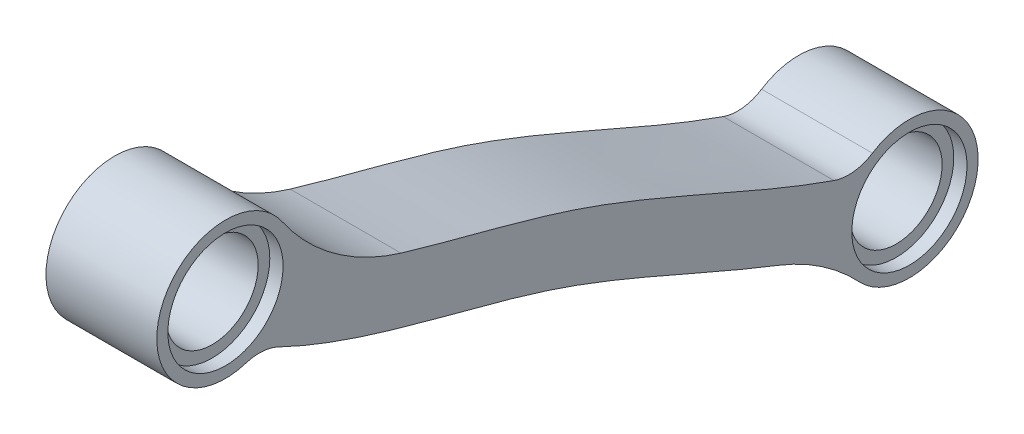
from build123d import *

# Parameters (mm, degrees)
BOSS_EXTRUDE1_START     = -2.5
BOSS_EXTRUDE1_OUTLINE_R = 2.075
BOSS_EXTRUDE1_DEPTH     = 5
FILLET1_R               = 10
FILLET2_R               = 2
SKETCH6_R               = 2.6
CUT_EXTRUDE3_DEPTH      = 0.6
CUT_EXTRUDE4_START      = -0.6
SKETCH7_R               = 2.6
CUT_EXTRUDE4_DEPTH      = 0.6


# Read off the part's stored shape, not the designer's step: Boss-Extrude1
with BuildPart() as part:
    # Boss-Extrude1 outline → Boss-Extrude1 (new body)
    with BuildSketch(Plane(origin=(0, 0, 0), x_dir=(0, 0, -1), z_dir=(1, 0, 0)).offset(BOSS_EXTRUDE1_START)):
        with BuildLine():
            add(Edge.make_bspline(
                [(-11.467537503, 5.350641642), (-9.989640807, 4.583198508), (-7.178473446, 3.56515844), (-2.794711607, 2.423489001), (1.31753402, 1.289926051), (5.278860449, -0.285822235), (9.053028754, -1.966642772), (11.935810136, -3.144477132), (13.583881592, -3.694358455), (13.981041238, -3.818362685)],
                knots=[0.086674, 0.086674, 0.086674, 0.086674, 0.25, 0.375, 0.5, 0.625, 0.75, 0.875, 0.914505017, 0.914505017, 0.914505017, 0.914505017], degree=3))
            ThreePointArc((-11.467537503, 5.350641642), (-17.181514848, 7.27580405), (-12.959070193, 2.971533086))
            add(Edge.make_bspline(
                [(-12.959070193, 2.971533086), (-12.497149124, 2.725216721), (-10.724559711, 1.865083664), (-7.538415314, 0.763759759), (-3.469271241, -0.293699416), (0.432825124, -1.371499483), (4.151444935, -2.850197037), (7.925726422, -4.529354156), (10.977952232, -5.779484012), (12.799789723, -6.384662727), (13.276371809, -6.531370761)],
                knots=[0.080415635, 0.080415635, 0.080415635, 0.080415635, 0.125, 0.25, 0.375, 0.5, 0.625, 0.75, 0.875, 0.9184538, 0.9184538, 0.9184538, 0.9184538], degree=3))
            ThreePointArc((13.276371809, -6.531370761), (19.30544163, -6.649326649), (13.981041238, -3.818362685))
        make_face()
        with Locations((16.305, -5.87)):
            Circle(BOSS_EXTRUDE1_OUTLINE_R, mode=Mode.SUBTRACT)
        with Locations((-14.555, 5.629165125)):
            Circle(BOSS_EXTRUDE1_OUTLINE_R, mode=Mode.SUBTRACT)
    extrude(amount=BOSS_EXTRUDE1_DEPTH)

    # Fillet1
    fillet1_edges = [part.edges().sort_by_distance(p)[0] for p in [
        (0, -6.531370761, -13.276371809),
        (0, 5.350641642, 11.467537503),
    ]]
    fillet(fillet1_edges, radius=FILLET1_R)

    # Fillet2
    fillet2_edges = [part.edges().sort_by_distance(p)[0] for p in [
        (0, -3.818362685, -13.981041238),
        (0, 2.971533086, 12.959070193),
    ]]
    fillet(fillet2_edges, radius=FILLET2_R)

    # Sketch6 → Cut-Extrude3 (cut)
    with BuildSketch(Plane(origin=(2.5, 0, 0), x_dir=(0, 0, -1), z_dir=(1, 0, 0))):
        with Locations((-14.555, 5.629165125)):
            Circle(SKETCH6_R)
        with Locations((16.305, -5.87)):
            Circle(SKETCH6_R)
    extrude(amount=-CUT_EXTRUDE3_DEPTH, mode=Mode.SUBTRACT)

    # Sketch7 → Cut-Extrude4 (cut)
    with BuildSketch(Plane.ZY.offset(2.5).offset(CUT_EXTRUDE4_START)):
        with Locations(Location((14.555, 5.629165125, 0), (0, 0, 180))):
            Circle(SKETCH7_R)
        with Locations(Location((-16.305, -5.87, 0), (0, 0, 180))):
            Circle(SKETCH7_R)
    extrude(amount=CUT_EXTRUDE4_DEPTH, mode=Mode.SUBTRACT)


solid = part.part
